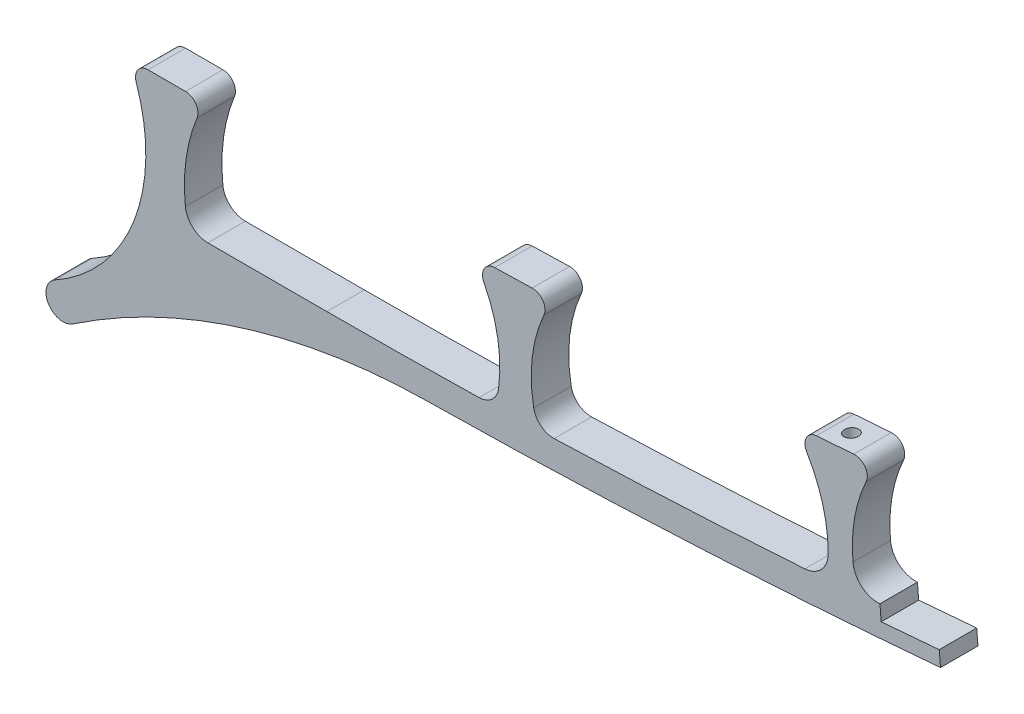
from build123d import *

# Parameters (mm, degrees)
BOSS_EXTRUDE5_DEPTH = 4.7625
SKETCH6_R           = 1.778
CUT_EXTRUDE3_DEPTH  = 504.733086563
CUT_EXTRUDE4_START  = 3.556
SKETCH7_R           = 3.048
SKETCH7_R_2         = 1.778
CUT_EXTRUDE4_DEPTH  = 505.502600354
CUT_EXTRUDE5_DEPTH  = 506.075936751


with BuildPart() as part:
    # Sketch1 → Boss-Extrude5 (new, symmetric)
    with BuildSketch(Plane(origin=(0, 0, 4.097149242), x_dir=(-1, 0, 0), z_dir=(0, 0, -1))):
        with BuildLine():
            Line((4.980483945, -43.087244707), (5.013364858, -50.687454907))
            add(Edge.make_bspline(
                [(266.801551376, -61.551589611), (261.350884009, -61.078554924), (250.433518448, -60.153958667), (228.701217873, -58.434486699), (190.548987698, -55.763104255), (136.042529388, -52.86929541), (81.4824687, -51.236835025), (43.240954482, -50.737883821), (21.43842692, -50.650632415), (10.483916541, -50.667450636), (5.013364858, -50.687454907)],
                knots=[4.0417e-05, 4.0417e-05, 4.0417e-05, 4.0417e-05, 0.062531963, 0.125023508, 0.2500066, 0.499972783, 0.749938966, 0.874922057, 0.937413603, 0.999905149, 0.999905149, 0.999905149, 0.999905149], degree=3))
            add(Edge.make_bspline(
                [(398.35171036, -68.196818162), (396.265786035, -68.16801087), (352.35609282, -67.485074441), (308.459309619, -65.190615284), (266.801551376, -61.551589611)],
                knots=[0.388247103, 0.388247103, 0.388247103, 0.388247103, 0.401472843, 0.666666775, 0.666666775, 0.666666775, 0.666666775], degree=3))
            ThreePointArc((398.35171036, -68.196818162), (445.202941045, -75.692238551), (487.961522574, -96.257326662))
            ThreePointArc((487.961522574, -96.257326662), (494.102034598, -94.922101367), (492.499924864, -88.845757162))
            ThreePointArc((492.499924864, -88.845757162), (472.347982204, -65.669309605), (471.824439099, -34.961421092))
            ThreePointArc((471.824439099, -34.961421092), (471.408544547, -32.082865726), (468.823110549, -30.750731982))
            Line((468.823110549, -30.750731982), (464.060610549, -30.750731982))
            Line((464.060610549, -30.750731982), (459.298110549, -30.750731982))
            ThreePointArc((459.298110549, -30.750731982), (456.664489609, -32.15241144), (456.356218194, -35.119840174))
            ThreePointArc((456.356218194, -35.119840174), (459.13228847, -45.417631786), (459.332762362, -56.081162557))
            ThreePointArc((459.332762362, -56.081162557), (457.466080253, -59.753283819), (453.620807365, -61.230731982))
            Line((453.620807365, -61.230731985), (423.379813153, -61.230732209))
            add(Edge.make_bspline(
                [(384.69669435, -60.817291115), (385.490946639, -60.834366328), (398.38358415, -61.102948795), (411.282715888, -61.232192999), (423.379813153, -61.230732209)],
                knots=[0.584578013, 0.584578013, 0.584578013, 0.584578013, 0.589634714, 0.666658831, 0.666658831, 0.666658831, 0.666658831], degree=3))
            ThreePointArc((384.69669435, -60.817291115), (381.405012075, -59.519394431), (379.749008052, -56.392517605))
            ThreePointArc((379.749008052, -56.392517605), (379.962938882, -45.344267983), (383.481055682, -34.868942675))
            ThreePointArc((383.481055682, -34.868942675), (383.390574332, -31.793909155), (380.736068027, -30.23904122))
            add(Edge.make_bspline(
                [(380.736068027, -30.23904122), (377.567706075, -30.162607104), (374.399550345, -30.077611409), (371.231646974, -29.984054972)],
                knots=[0.564351213, 0.564351213, 0.564351213, 0.564351213, 0.584873669, 0.584873669, 0.584873669, 0.584873669], degree=3))
            ThreePointArc((371.231646974, -29.984054972), (368.497589908, -31.394357521), (368.242362423, -34.460116848))
            ThreePointArc((368.242362423, -34.460116848), (371.193755284, -45.109007001), (370.814996242, -56.152834368))
            ThreePointArc((370.814996242, -56.152834368), (368.993717842, -59.186422224), (365.637179655, -60.305958598))
            add(Edge.make_bspline(
                [(301.916083239, -57.118764264), (304.793492849, -57.314159562), (316.447125042, -58.077219349), (336.889920622, -59.214945623), (355.259103098, -59.96581465), (364.843153628, -60.280423029), (365.637179655, -60.305958598)],
                knots=[0.408750601, 0.408750601, 0.408750601, 0.408750601, 0.427107919, 0.483087827, 0.539067736, 0.544124431, 0.544124431, 0.544124431, 0.544124431], degree=3))
            ThreePointArc((301.916083239, -57.118764264), (297.703900514, -55.115863145), (295.996304567, -50.7755622))
            ThreePointArc((295.996304567, -50.7755622), (297.395526272, -40.599539879), (301.466201974, -31.168800195))
            ThreePointArc((301.466201974, -31.168800195), (301.565948035, -28.066269557), (298.971867926, -26.361454603))
            add(Edge.make_bspline(
                [(289.489598636, -25.664595471), (292.649719638, -25.90542225), (295.810491414, -26.137709697), (298.971867926, -26.361454603)],
                knots=[0.377389823, 0.377389823, 0.377389823, 0.377389823, 0.397912285, 0.397912285, 0.397912285, 0.397912285], degree=3))
            ThreePointArc((289.489598636, -25.664595471), (286.640803233, -27.018955044), (286.365734252, -30.161288915))
            ThreePointArc((286.365734252, -30.161288915), (289.309950073, -39.618561113), (289.709550194, -49.515465879))
            ThreePointArc((289.709550194, -49.515465879), (287.468803622, -53.805389908), (282.855937937, -55.270266537))
            Line((282.855937937, -55.270266537), (268.113256948, -54.036580381))
            add(Edge.make_bspline(
                [(268.113256948, -54.036580381), (262.634745624, -53.56111419), (251.663313863, -52.628696852), (229.81175043, -50.89541865), (191.471827261, -48.203857237), (136.679597141, -45.286916485), (81.835702382, -43.641470214), (43.402846546, -43.138474088), (21.480818831, -43.050269737), (10.476996172, -43.067138198), (4.980483945, -43.087244707)],
                knots=[-0.002434158, -0.002434158, -0.002434158, -0.002434158, 0.060213256, 0.12286067, 0.248155497, 0.498745152, 0.749334808, 0.874629635, 0.937277049, 0.999924463, 0.999924463, 0.999924463, 0.999924463], degree=3))
        make_face()
    boss_extrude5 = extrude(amount=BOSS_EXTRUDE5_DEPTH, both=True)

    # Sketch6 → Cut-Extrude3 (cut, through all)
    with BuildSketch(Plane(origin=(0.32087569, -4.366204823, 0), x_dir=(0.9973104440526221, 0.07329309778936742, 0), z_dir=(-0.07329309778936742, 0.9973104440526221, 0))):
        with Locations((-295.980145151, -4.097149242)):
            Circle(SKETCH6_R)
    cut_extrude3 = extrude(amount=-CUT_EXTRUDE3_DEPTH, mode=Mode.SUBTRACT)

    # Sketch7 → Cut-Extrude4 (cut)
    with BuildSketch(Plane(origin=(3.065947832, -41.718823267, 0), x_dir=(-0.9946544730103679, -0.07309790847145088, 0.07293267510222654), z_dir=(-0.07329309778936742, 0.9973104440526221, 0)).offset(CUT_EXTRUDE4_START)):
        with Locations((295.490726509, -17.500385777)):
            Circle(SKETCH7_R)
        with Locations((295.490726509, -17.500385777)):
            Circle(SKETCH7_R_2, mode=Mode.SUBTRACT)
    cut_extrude4 = extrude(amount=-CUT_EXTRUDE4_DEPTH, mode=Mode.SUBTRACT)

    # Mirror4: Boss-Extrude5, Cut-Extrude3, Cut-Extrude4 across plane
    add(boss_extrude5.mirror(Plane(origin=(-4.793985166, 0.020740296, 8.859649242), x_dir=(0, 0, 1), z_dir=(-0.9999906416249494, 0.004326275825933448, 0))))
    add(cut_extrude3.mirror(Plane(origin=(-4.793985166, 0.020740296, 8.859649242), x_dir=(0, 0, 1), z_dir=(-0.9999906416249494, 0.004326275825933448, 0))), mode=Mode.SUBTRACT)
    add(cut_extrude4.mirror(Plane(origin=(-4.793985166, 0.020740296, 8.859649242), x_dir=(0, 0, 1), z_dir=(-0.9999906416249494, 0.004326275825933448, 0))), mode=Mode.SUBTRACT)

    # Sketch9 → Cut-Extrude5 (cut, through all)
    with BuildSketch(Plane(origin=(0, 0, -0.665350758), x_dir=(-1, 0, 0), z_dir=(0, 0, -1))):
        Polygon((282.855937937, -55.270266537), (268.113256948, -54.036580381), (271.226711866, -16.830462442), (-501.730233012, -16.830462442), (-501.730233012, -147.179806135), (267.467078991, -61.609602167), (267.795541806, -57.83331017), (282.538222795, -59.066996326), align=None)
    extrude(amount=-CUT_EXTRUDE5_DEPTH, mode=Mode.SUBTRACT)


solid = part.part
